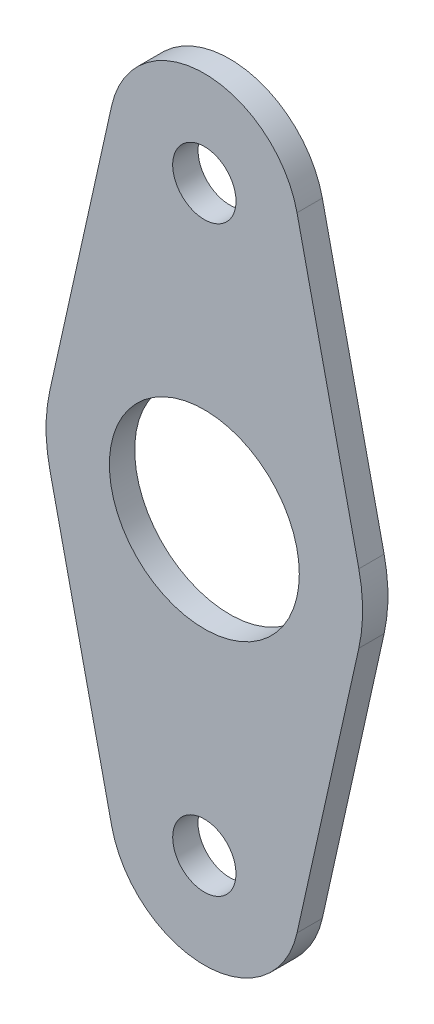
from build123d import *

# Parameters (mm, degrees)
SKETCH1_R           = 7.5
SKETCH1_R_2         = 2.5
BOSS_EXTRUDE1_DEPTH = 1


with BuildPart() as part:
    # Sketch1 → Boss-Extrude1 (new, symmetric)
    with BuildSketch(Plane.XY):
        with BuildLine():
            Line((-7.320634018, 24.630434783), (-12.201056696, 2.717391304))
            ThreePointArc((-12.201056696, 2.717391304), (-12.5, 0), (-12.201056696, -2.717391304))
            Line((-12.201056696, -2.717391304), (-7.320634018, -24.630434783))
            ThreePointArc((-7.320634018, -24.630434783), (0, -30.5), (7.320634018, -24.630434783))
            Line((7.320634018, -24.630434783), (12.201056696, -2.717391304))
            ThreePointArc((12.201056696, -2.717391304), (12.5, 0), (12.201056696, 2.717391304))
            Line((12.201056696, 2.717391304), (7.320634018, 24.630434783))
            ThreePointArc((7.320634018, 24.630434783), (0, 30.5), (-7.320634018, 24.630434783))
        make_face()
        Circle(SKETCH1_R, mode=Mode.SUBTRACT)
        with Locations((0, 23)):
            Circle(SKETCH1_R_2, mode=Mode.SUBTRACT)
        with Locations((0, -23)):
            Circle(SKETCH1_R_2, mode=Mode.SUBTRACT)
    extrude(amount=BOSS_EXTRUDE1_DEPTH, both=True)


solid = part.part
